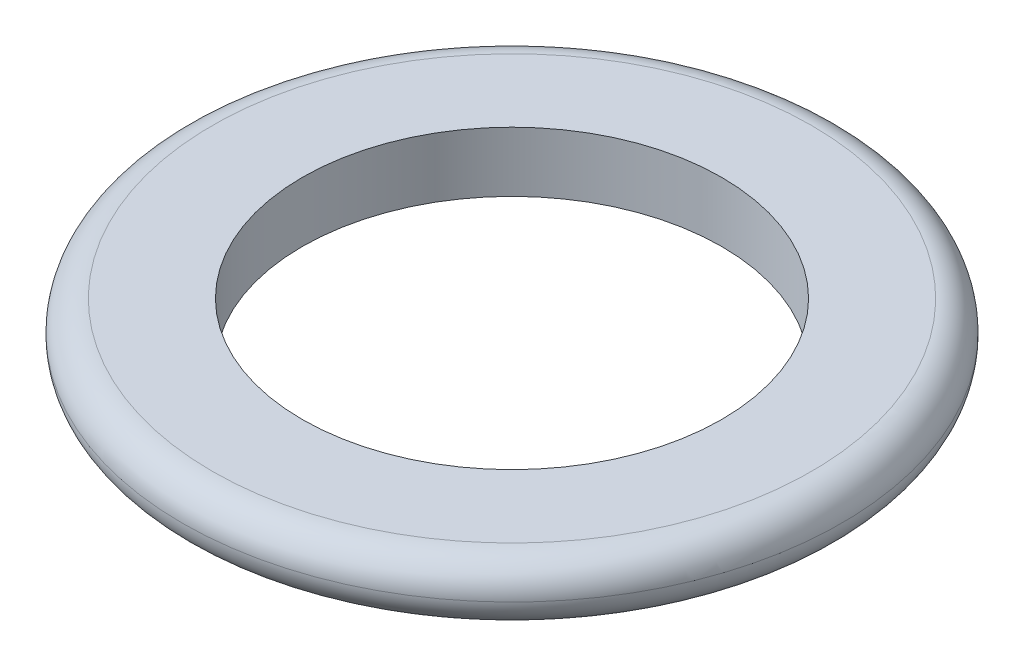
from build123d import *

# Parameters (mm, degrees)
SKETCH_1_R      = 5.5
SKETCH_1_R_2    = 3.5
EXTRUDE_1_DEPTH = 0.5
FILLET_1_R      = 0.5


with BuildPart() as part:
    # 草图1 → 凸台-拉伸1 (new, symmetric)
    with BuildSketch(Plane(origin=(0, 0, 0), x_dir=(1, 0, 0), z_dir=(0, 1, 0))):
        with Locations(Location((0, 0, 0), (0, 0, 270))):
            Circle(SKETCH_1_R)
        with Locations(Location((0, 0, 0), (0, 0, 270))):
            Circle(SKETCH_1_R_2, mode=Mode.SUBTRACT)
    extrude(amount=EXTRUDE_1_DEPTH, both=True)

    # 圆角1
    fillet_1_edges = [part.edges().sort_by_distance(p)[0] for p in [
        (0, -0.5, -5.5),
        (0, 0.5, -5.5),
    ]]
    fillet(fillet_1_edges, radius=FILLET_1_R - 0.0001)  # a hair under: the kernel refuses the full size


solid = part.part
